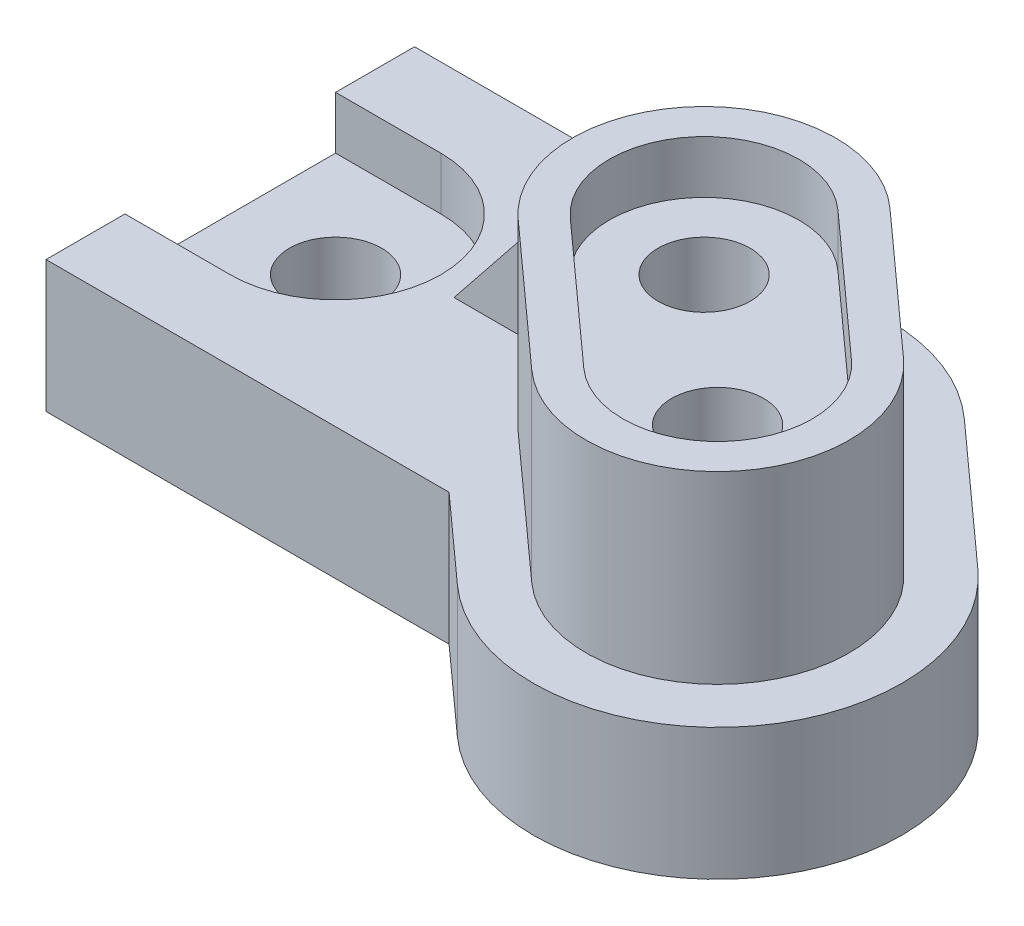
from build123d import *

# Parameters (mm, degrees)
BOSS_EXTRUDE1_DEPTH    = 25
BOSS_EXTRUDE2_DEPTH    = 35
CUT_EXTRUDE1_DEPTH     = 10
M20_TAPPED_HOLE1_D     = 17.5
M20_TAPPED_HOLE1_DEPTH = 20
M20_TAPPED_HOLE1_TIP   = 5.257530416
M20_TAPPED_HOLE2_D     = 17.5
M20_TAPPED_HOLE2_DEPTH = 27.5
M20_TAPPED_HOLE2_TIP   = 5.257530416
CUT_EXTRUDE2_START     = -10
SKETCH8_R              = 8.75
CUT_EXTRUDE2_DEPTH     = 10
SKETCH9_W              = 20
SKETCH9_H              = 2.5
BOSS_EXTRUDE4_DEPTH    = 25
CHAMFER1_SIZE          = 25
CHAMFER1_SIZE_2        = 20


with BuildPart() as part:
    # Sketch1 → Boss-Extrude1 (new body)
    with BuildSketch(Plane(origin=(0, 0, 0), x_dir=(1, 0, 0), z_dir=(0, 1, 0))):
        with BuildLine():
            Line((0, 70), (0, 0))
            Line((0, 0), (76.556127607, 0))
            Line((76.556127607, 0), (92.569250972, -14.430749028))
            ThreePointArc((92.569250972, -14.430749028), (142, -11.861498055), (139.430749028, 37.569250972))
            Line((139.430749028, 37.569250972), (113.430749028, 61))
            ThreePointArc((113.430749028, 61), (102.549900398, 67.672618505), (90, 70))
            Line((90, 70), (0, 70))
        make_face()
    extrude(amount=BOSS_EXTRUDE1_DEPTH)

    # Sketch2 → Boss-Extrude2 (add)
    with BuildSketch(Plane(origin=(0, 25, 0), x_dir=(1, 0, 0), z_dir=(0, 1, 0))):
        with BuildLine():
            Line((99.263750694, -7.002177599), (73.263750694, 16.428571429))
            ThreePointArc((73.263750694, 16.428571429), (71.428571429, 51.736249306), (106.736249306, 53.571428571))
            Line((106.736249306, 53.571428571), (132.736249306, 30.140679544))
            ThreePointArc((132.736249306, 30.140679544), (134.571428571, -5.166998333), (99.263750694, -7.002177599))
        make_face()
    extrude(amount=BOSS_EXTRUDE2_DEPTH)

    # Sketch3 → Cut-Extrude1 (cut)
    with BuildSketch(Plane(origin=(0, 60, 0), x_dir=(1, 0, 0), z_dir=(0, 1, 0))):
        with BuildLine():
            Line((103.9499005, -1.802177599), (77.9499005, 21.628571429))
            ThreePointArc((77.9499005, 21.628571429), (76.628571429, 47.0500995), (102.0500995, 48.371428571))
            Line((102.0500995, 48.371428571), (128.0500995, 24.940679544))
            ThreePointArc((128.0500995, 24.940679544), (129.371428571, -0.480848528), (103.9499005, -1.802177599))
        make_face()
    extrude(amount=-CUT_EXTRUDE1_DEPTH, mode=Mode.SUBTRACT)

    # M20 Tapped Hole1
    with Locations(Plane(origin=(90, 50, -35), x_dir=(0, 0, 1), z_dir=(0, 1, 0))):
        with Locations((0, 0), (23.430749028, 26)):
            Hole(M20_TAPPED_HOLE1_D / 2, depth=M20_TAPPED_HOLE1_DEPTH)
            with Locations((0, 0, -(M20_TAPPED_HOLE1_DEPTH + M20_TAPPED_HOLE1_TIP / 2))):  # 118° drill point
                Cone(0, M20_TAPPED_HOLE1_D / 2, M20_TAPPED_HOLE1_TIP, mode=Mode.SUBTRACT)

    # M20 Tapped Hole2
    with Locations(Plane(origin=(20, 25, -35), x_dir=(0, 0, 1), z_dir=(0, 1, 0))):
        with Locations((0, 0)):
            Hole(M20_TAPPED_HOLE2_D / 2, depth=M20_TAPPED_HOLE2_DEPTH)
            with Locations((0, 0, -(M20_TAPPED_HOLE2_DEPTH + M20_TAPPED_HOLE2_TIP / 2))):  # 118° drill point
                Cone(0, M20_TAPPED_HOLE2_D / 2, M20_TAPPED_HOLE2_TIP, mode=Mode.SUBTRACT)

    # Sketch8 → Cut-Extrude2 (cut)
    with BuildSketch(Plane(origin=(0, 25, 0), x_dir=(1, 0, 0), z_dir=(0, 1, 0)).offset(CUT_EXTRUDE2_START)):
        with BuildLine():
            Line((20, 55), (0, 55))
            Line((0, 55), (0, 15))
            Line((0, 15), (20, 15))
            ThreePointArc((20, 15), (40, 35), (20, 55))
        make_face()
        with Locations(Location((20, 35, 0), (0, 0, 270))):
            Circle(SKETCH8_R, mode=Mode.SUBTRACT)
    extrude(amount=CUT_EXTRUDE2_DEPTH, mode=Mode.SUBTRACT)


with BuildPart() as body_2:
    # Sketch9 → Boss-Extrude4 (new body)
    with BuildSketch(Plane(origin=(0, 25, 0), x_dir=(1, 0, 0), z_dir=(0, 1, 0))):
        with Locations((55, 33.75)):
            Rectangle(SKETCH9_W, SKETCH9_H)
        with Locations((55, 36.25)):
            Rectangle(SKETCH9_W, SKETCH9_H)
    extrude(amount=BOSS_EXTRUDE4_DEPTH)

    # Chamfer1
    # the kernel refuses this chamfer: 25, 20 mm, written as the material it takes off along each edge
    with BuildSketch(Plane(origin=(45, 50, 31.971090443), x_dir=(-0.024223843712695276, -0.9997065596442702, 0), z_dir=(0, 0, -1))) as chamfer1_piece_1:
        Polygon((CHAMFER1_SIZE * 0.999706559644, -CHAMFER1_SIZE * 0.0242238437127), (-CHAMFER1_SIZE_2 * 0.0242238437127, -CHAMFER1_SIZE_2 * 0.999706559644), (0, 0), align=None)
    extrude(amount=133.942180887, mode=Mode.SUBTRACT)


solid = Compound([part.part, body_2.part])
